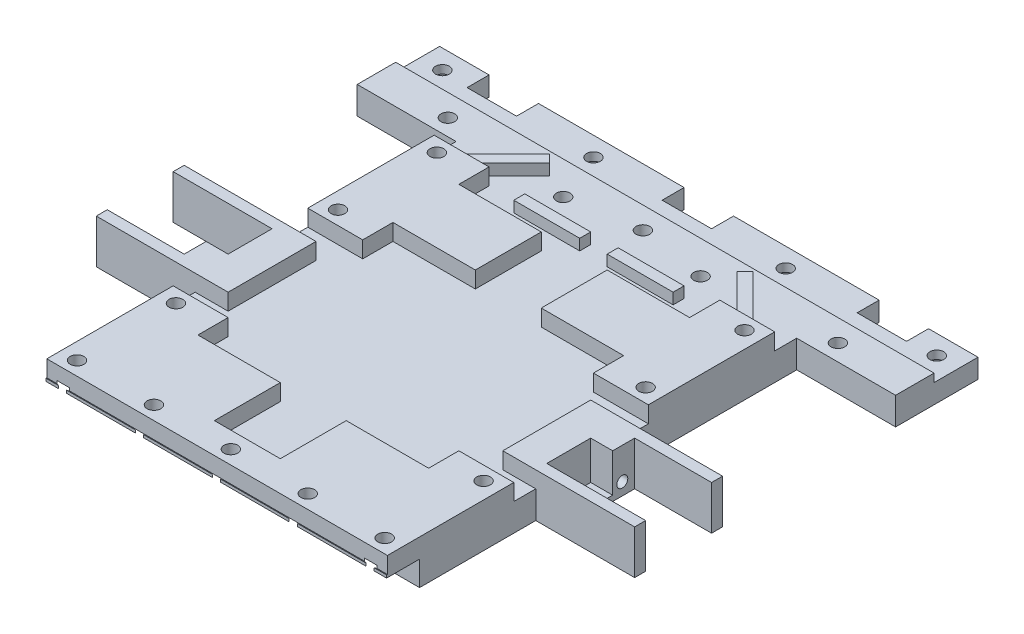
from build123d import *

# Parameters (mm, degrees)
KSZTA_T_OGOLNY_DEPTH            = 5
MIEJSCE_NA_SHARPY_DEPTH         = 19
MIEJSCE_NA_SHARPY_DEPTH_BACK    = 16.272781758
WCI_CIE_NA_SHARP_W              = 15
WCI_CIE_NA_SHARP_H              = 12
MIEJSCE_START                   = 5
WCI_CIE_NA_PO_CZENIEP_UGU_W     = 100
WCI_CIE_NA_PO_CZENIEP_UGU_H     = 8
MIEJSCE_NA_P_UG_DEPTH           = 1.5
WCI_CIA_NA_KTIRY_W              = 9
WCI_CIA_NA_KTIRY_H              = 14
MIEJSCE_NA_KTIR_DEPTH           = 3
SILNIKI_START                   = 5
PODWY_SZENIE_NA_SILNIKI_R       = 1.25
SILNIKI_PODWYZSZENIE_DEPTH      = 3
SILNIKI_DZIURY_DEPTH            = 35
SILNIKI_DZIURY_DEPTH_BACK       = 31
PODWY_SZENIE_NA_SILNIKI_3_R     = 1.25
OTWORY_NA_P_UG_DEPTH            = 42
OTWORY_NA_P_UG_DEPTH_BACK       = 56
OTWORY_NA_P_UG_2_R              = 1.25
OTWORY_TY_DEPTH                 = 54
OTWORY_TY_DEPTH_BACK            = 71
OTWORY_TY_RYS_R                 = 1.25
OTWORY_NA_PCB_PLUG_DEPTH        = 40
OTWORY_NA_PCB_PLUG_DEPTH_BACK   = 40.893066204
OTWORY_RYS_R                    = 1.25
KABLE_KTIR_DEPTH                = 61
KABLE_KTIR_DEPTH_BACK           = 85.532250354
MIEJSCE_NA_KABLE_KTIR_W         = 9
MIEJSCE_NA_KABLE_KTIR_H         = 4
OTWORY_MOCUJACE_KTIR_DEPTH      = 70
OTWORY_MOCUJACE_KTIR_DEPTH_BACK = 110.581826372
OTWORY_NA_MOCOWANIE_KTIR_RYS_R  = 1.25
GLOWKI_SRUB_R                   = 2.75
MIEJSCE_NA_SRUBKI_DEPTH         = 2
SKROCENIE_W                     = 62
SKROCENIE_H                     = 4.35
SKROCENIE_TYLU_DEPTH            = 5
WZMOCNIENIE_BOK_DEPTH           = 8
PRAWA_START                     = -15
PRAWA_STRONA_R                  = 1
PRAWA_STRONA_OTWOR_DEPTH        = 10
LEWA_START                      = 4
LEWA_STRONA_R                   = 1
LEWA_STRONA_OTWOR_DEPTH         = 10
ZAOKR_GLENIE1_R                 = 0.25
SZKIC1_W                        = 4
SZKIC1_H                        = 8
MIEJSCE_SHARP_DEPTH             = 7
GLOWKI_SRUB_2_R                 = 2.75
WIEKSZE_SROBKI_DEPTH            = 5.5
SZKIC3_W                        = 42
SZKIC3_H                        = 5.5
PODWYZSZENIE_TYL_DEPTH          = 3
OTWORY_TY_RYS_2_R               = 1.25
SROBKI_TYL_DEPTH                = 21
SZKIC5_W                        = 62.360867186
SZKIC5_H                        = 8
PODBICIETYL_DEPTH               = 4.5
ZWEZENIE_SZEROKOSCI_DEPTH       = 22
ZWEZENIE_SZEROKOSCI_DEPTH_BACK  = 46
SZKIC7_W                        = 1
SZKIC7_H                        = 65.630555857
SZKIC8_W                        = 12
SZKIC8_H                        = 2
SZARPY_PRZOD_MIEJSCA_DEPTH      = 2


with BuildPart() as part:
    # Kształt ogólny → Kształt ogolny (new body)
    with BuildSketch(Plane(origin=(0, 0, 0), x_dir=(1, 0, 0), z_dir=(0, 1, 0))):
        Polygon((0, 0), (-100, 0), (-100, -15), (-81, -15), (-81, -46.5), (-100, -46.5), (-100, -62.5), (-81, -62.5), (-81, -94), (-19, -94), (-19, -62.5), (0, -62.5), (0, -46.5), (-19, -46.5), (-19, -15), (0, -15), align=None)
    extrude(amount=KSZTA_T_OGOLNY_DEPTH)

    # Wcięcie na sharp → Miejsce na sharpy (cut, two sides: drawn at the far end of the back side and taken through both)
    with BuildSketch(Plane(origin=(0, 5, 0), x_dir=(1, 0, 0), z_dir=(0, 1, 0)).offset(-MIEJSCE_NA_SHARPY_DEPTH_BACK)):
        with Locations((-92.5, -54.5)):
            Rectangle(WCI_CIE_NA_SHARP_W, WCI_CIE_NA_SHARP_H)
        with Locations((-7.5, -54.5)):
            Rectangle(WCI_CIE_NA_SHARP_W, WCI_CIE_NA_SHARP_H)
    extrude(amount=MIEJSCE_NA_SHARPY_DEPTH + MIEJSCE_NA_SHARPY_DEPTH_BACK, mode=Mode.SUBTRACT)

    # Wcięcie na połączeniepługu → Miejsce na pług (cut)
    with BuildSketch(Plane(origin=(0, 0, 0), x_dir=(1, 0, 0), z_dir=(0, 1, 0)).offset(MIEJSCE_START)):
        with Locations((-50, -4)):
            Rectangle(WCI_CIE_NA_PO_CZENIEP_UGU_W, WCI_CIE_NA_PO_CZENIEP_UGU_H)
    extrude(amount=-MIEJSCE_NA_P_UG_DEPTH, mode=Mode.SUBTRACT)

    # Wcięcia na ktiry → Miejsce na ktir (cut)
    with BuildSketch(Plane(origin=(0, 0, 0), x_dir=(1, 0, 0), z_dir=(0, 1, 0))):
        with Locations((-85.5, -7)):
            Rectangle(WCI_CIA_NA_KTIRY_W, WCI_CIA_NA_KTIRY_H)
        with Locations((-50, -7)):
            Rectangle(WCI_CIA_NA_KTIRY_W, WCI_CIA_NA_KTIRY_H)
        with Locations((-14.5, -7)):
            Rectangle(WCI_CIA_NA_KTIRY_W, WCI_CIA_NA_KTIRY_H)
    extrude(amount=MIEJSCE_NA_KTIR_DEPTH, mode=Mode.SUBTRACT)

    # Podwyższenie na silniki → Silniki - podwyzszenie (add)
    # profile 1 of 4: a face of its own
    with BuildSketch(Plane(origin=(0, 0, 0), x_dir=(1, 0, 0), z_dir=(0, 1, 0)).offset(SILNIKI_START)):
        Polygon((-81, -66.5), (-71, -66.5), (-71, -72), (-56, -72), (-56, -84), (-71, -84), (-71, -89.5), (-81, -89.5), align=None)
        with Locations(Location((-78, -69, 0), (0, 0, 270))):
            Circle(PODWY_SZENIE_NA_SILNIKI_R, mode=Mode.SUBTRACT)
        with Locations(Location((-78, -87, 0), (0, 0, 270))):
            Circle(PODWY_SZENIE_NA_SILNIKI_R, mode=Mode.SUBTRACT)
    # profile 2 of 4: a face of its own
    with BuildSketch(Plane(origin=(0, 0, 0), x_dir=(1, 0, 0), z_dir=(0, 1, 0)).offset(SILNIKI_START)):
        Polygon((-19, -89.5), (-29, -89.5), (-29, -84), (-44, -84), (-44, -72), (-29, -72), (-29, -66.5), (-19, -66.5), align=None)
        with Locations(Location((-22, -69, 0), (0, 0, 270))):
            Circle(PODWY_SZENIE_NA_SILNIKI_R, mode=Mode.SUBTRACT)
        with Locations(Location((-22, -87, 0), (0, 0, 270))):
            Circle(PODWY_SZENIE_NA_SILNIKI_R, mode=Mode.SUBTRACT)
    # profile 3 of 4: a face of its own
    with BuildSketch(Plane(origin=(0, 0, 0), x_dir=(1, 0, 0), z_dir=(0, 1, 0)).offset(SILNIKI_START)):
        Polygon((-81, -19), (-71, -19), (-71, -24.5), (-56, -24.5), (-56, -36.5), (-71, -36.5), (-71, -42), (-81, -42), align=None)
        with Locations(Location((-78, -21.5, 0), (0, 0, 270))):
            Circle(PODWY_SZENIE_NA_SILNIKI_R, mode=Mode.SUBTRACT)
        with Locations(Location((-78, -39.5, 0), (0, 0, 270))):
            Circle(PODWY_SZENIE_NA_SILNIKI_R, mode=Mode.SUBTRACT)
    # profile 4 of 4: a face of its own
    with BuildSketch(Plane(origin=(0, 0, 0), x_dir=(1, 0, 0), z_dir=(0, 1, 0)).offset(SILNIKI_START)):
        Polygon((-19, -19), (-29, -19), (-29, -24.5), (-44, -24.5), (-44, -36.5), (-29, -36.5), (-29, -42), (-19, -42), align=None)
        with Locations(Location((-22, -21.5, 0), (0, 0, 270))):
            Circle(PODWY_SZENIE_NA_SILNIKI_R, mode=Mode.SUBTRACT)
        with Locations(Location((-22, -39.5, 0), (0, 0, 270))):
            Circle(PODWY_SZENIE_NA_SILNIKI_R, mode=Mode.SUBTRACT)
    extrude(amount=SILNIKI_PODWYZSZENIE_DEPTH)

    # Podwyższenie na silniki<3> → Silniki -dziury (cut, two sides: drawn at the far end of the back side and taken through both)
    with BuildSketch(Plane(origin=(0, 0, 0), x_dir=(1, 0, 0), z_dir=(0, 1, 0)).offset(-SILNIKI_DZIURY_DEPTH_BACK)):
        with Locations(Location((-78, -87, 0), (0, 0, 270))):
            Circle(PODWY_SZENIE_NA_SILNIKI_3_R)
        with Locations(Location((-78, -69, 0), (0, 0, 270))):
            Circle(PODWY_SZENIE_NA_SILNIKI_3_R)
        with Locations(Location((-78, -39.5, 0), (0, 0, 270))):
            Circle(PODWY_SZENIE_NA_SILNIKI_3_R)
        with Locations(Location((-78, -21.5, 0), (0, 0, 270))):
            Circle(PODWY_SZENIE_NA_SILNIKI_3_R)
        with Locations(Location((-22, -21.5, 0), (0, 0, 270))):
            Circle(PODWY_SZENIE_NA_SILNIKI_3_R)
        with Locations(Location((-22, -39.5, 0), (0, 0, 270))):
            Circle(PODWY_SZENIE_NA_SILNIKI_3_R)
        with Locations(Location((-22, -69, 0), (0, 0, 270))):
            Circle(PODWY_SZENIE_NA_SILNIKI_3_R)
        with Locations(Location((-22, -87, 0), (0, 0, 270))):
            Circle(PODWY_SZENIE_NA_SILNIKI_3_R)
    extrude(amount=SILNIKI_DZIURY_DEPTH + SILNIKI_DZIURY_DEPTH_BACK, mode=Mode.SUBTRACT)

    # Otwory na p_ug 2 → Otwory na p_ug (cut, two sides: drawn at the far end of the back side and taken through both)
    with BuildSketch(Plane(origin=(0, 0, 0), x_dir=(1, 0, 0), z_dir=(0, 1, 0)).offset(-OTWORY_NA_P_UG_DEPTH_BACK)):
        with Locations(Location((-95, -3.5, 0), (0, 0, 90))):
            Circle(OTWORY_NA_P_UG_2_R)
        with Locations(Location((-67.5, -3.5, 0), (0, 0, 90))):
            Circle(OTWORY_NA_P_UG_2_R)
        with Locations(Location((-32.5, -3.5, 0), (0, 0, 90))):
            Circle(OTWORY_NA_P_UG_2_R)
        with Locations(Location((-5, -3.5, 0), (0, 0, 90))):
            Circle(OTWORY_NA_P_UG_2_R)
    extrude(amount=OTWORY_NA_P_UG_DEPTH + OTWORY_NA_P_UG_DEPTH_BACK, mode=Mode.SUBTRACT)

    # Otwory tył(rys) → Otwory tył (cut, two sides: drawn at the far end of the back side and taken through both)
    with BuildSketch(Plane(origin=(0, 0, 0), x_dir=(1, 0, 0), z_dir=(0, 1, 0)).offset(-OTWORY_TY_DEPTH_BACK)):
        with Locations(Location((-50, -87, 0), (0, 0, 270))):
            Circle(OTWORY_TY_RYS_R)
        with Locations(Location((-36, -87, 0), (0, 0, 270))):
            Circle(OTWORY_TY_RYS_R)
        with Locations(Location((-64, -87, 0), (0, 0, 270))):
            Circle(OTWORY_TY_RYS_R)
    extrude(amount=OTWORY_TY_DEPTH + OTWORY_TY_DEPTH_BACK, mode=Mode.SUBTRACT)

    # Otwory rys → Otwory na pcb/plug (cut, two sides: drawn at the far end of the back side and taken through both)
    with BuildSketch(Plane(origin=(0, 0, 0), x_dir=(1, 0, 0), z_dir=(0, 1, 0)).offset(-OTWORY_NA_PCB_PLUG_DEPTH_BACK)):
        with Locations(Location((-62.5, -14, 0), (0, 0, 90))):
            Circle(OTWORY_RYS_R)
        with Locations(Location((-37.5, -14, 0), (0, 0, 90))):
            Circle(OTWORY_RYS_R)
    extrude(amount=OTWORY_NA_PCB_PLUG_DEPTH + OTWORY_NA_PCB_PLUG_DEPTH_BACK, mode=Mode.SUBTRACT)

    # Miejsce na kable ktir → Kable ktir (cut, two sides: drawn at the far end of the back side and taken through both)
    with BuildSketch(Plane(origin=(0, 3.5, 0), x_dir=(1, 0, 0), z_dir=(0, 1, 0)).offset(-KABLE_KTIR_DEPTH_BACK)):
        with Locations((-50, -2)):
            Rectangle(MIEJSCE_NA_KABLE_KTIR_W, MIEJSCE_NA_KABLE_KTIR_H)
        with Locations((-14.5, -2)):
            Rectangle(MIEJSCE_NA_KABLE_KTIR_W, MIEJSCE_NA_KABLE_KTIR_H)
        with Locations((-85.5, -2)):
            Rectangle(MIEJSCE_NA_KABLE_KTIR_W, MIEJSCE_NA_KABLE_KTIR_H)
    extrude(amount=KABLE_KTIR_DEPTH + KABLE_KTIR_DEPTH_BACK, mode=Mode.SUBTRACT)

    # Otwory na mocowanie ktir rys → Otwory mocujace ktir (cut, two sides: drawn at the far end of the back side and taken through both)
    with BuildSketch(Plane(origin=(0, 3.5, 0), x_dir=(1, 0, 0), z_dir=(0, 1, 0)).offset(-OTWORY_MOCUJACE_KTIR_DEPTH_BACK)):
        with Locations(Location((-14.5, -12, 0), (0, 0, 270))):
            Circle(OTWORY_NA_MOCOWANIE_KTIR_RYS_R)
        with Locations(Location((-50, -12, 0), (0, 0, 270))):
            Circle(OTWORY_NA_MOCOWANIE_KTIR_RYS_R)
        with Locations(Location((-85.5, -12, 0), (0, 0, 270))):
            Circle(OTWORY_NA_MOCOWANIE_KTIR_RYS_R)
    extrude(amount=OTWORY_MOCUJACE_KTIR_DEPTH + OTWORY_MOCUJACE_KTIR_DEPTH_BACK, mode=Mode.SUBTRACT)

    # glowki srub → miejsce na srubki (cut)
    with BuildSketch(Plane(origin=(0, 0, 0), x_dir=(-1, 0, 0), z_dir=(0, -1, 0))):
        with Locations(Location((22, -21.5, 0), (0, 0, 90))):
            Circle(GLOWKI_SRUB_R)
        with Locations(Location((37.5, -14, 0), (0, 0, 90))):
            Circle(GLOWKI_SRUB_R)
        with Locations(Location((62.5, -14, 0), (0, 0, 90))):
            Circle(GLOWKI_SRUB_R)
        with Locations(Location((78, -21.5, 0), (0, 0, 90))):
            Circle(GLOWKI_SRUB_R)
        with Locations(Location((78, -39.5, 0), (0, 0, 90))):
            Circle(GLOWKI_SRUB_R)
        with Locations(Location((22, -39.5, 0), (0, 0, 90))):
            Circle(GLOWKI_SRUB_R)
        with Locations(Location((22, -69, 0), (0, 0, 90))):
            Circle(GLOWKI_SRUB_R)
        with Locations(Location((22, -87, 0), (0, 0, 90))):
            Circle(GLOWKI_SRUB_R)
        with Locations(Location((78, -87, 0), (0, 0, 90))):
            Circle(GLOWKI_SRUB_R)
        with Locations(Location((78, -69, 0), (0, 0, 90))):
            Circle(GLOWKI_SRUB_R)
        with Locations(Location((36, -87, 0), (0, 0, 90))):
            Circle(GLOWKI_SRUB_R)
        with Locations(Location((50, -87, 0), (0, 0, 90))):
            Circle(GLOWKI_SRUB_R)
        with Locations(Location((64, -87, 0), (0, 0, 90))):
            Circle(GLOWKI_SRUB_R)
        with Locations(Location((5, -3.5, 0), (0, 0, 90))):
            Circle(GLOWKI_SRUB_R)
        with Locations(Location((32.5, -3.5, 0), (0, 0, 90))):
            Circle(GLOWKI_SRUB_R)
        with Locations(Location((67.5, -3.5, 0), (0, 0, 90))):
            Circle(GLOWKI_SRUB_R)
        with Locations(Location((95, -3.5, 0), (0, 0, 90))):
            Circle(GLOWKI_SRUB_R)
    extrude(amount=-MIEJSCE_NA_SRUBKI_DEPTH, mode=Mode.SUBTRACT)

    # skrocenie → skrocenie tylu (cut)
    with BuildSketch(Plane(origin=(0, 0, 0), x_dir=(-1, 0, 0), z_dir=(0, -1, 0))):
        with Locations((50, -91.825)):
            Rectangle(SKROCENIE_W, SKROCENIE_H)
    extrude(amount=-SKROCENIE_TYLU_DEPTH, mode=Mode.SUBTRACT)

    # wzmocnienie → wzmocnienie bok (add)
    with BuildSketch(Plane.XZ):
        Polygon((0, 46.5), (-25, 46.5), (-25, 62.5), (0, 62.5), (0, 60.5), (-15, 60.5), (-15, 48.5), (0, 48.5), align=None)
        Polygon((-100, 62.5), (-75, 62.5), (-75, 46.5), (-100, 46.5), (-100, 48.5), (-85, 48.5), (-85, 60.5), (-100, 60.5), align=None)
    extrude(amount=-WZMOCNIENIE_BOK_DEPTH)

    # prawa strona → prawa strona otwor (cut)
    with BuildSketch(Plane(origin=(0, 0, 0), x_dir=(0, 0, -1), z_dir=(1, 0, 0)).offset(PRAWA_START)):
        with Locations((-50.75, 2.25)):
            Circle(PRAWA_STRONA_R)
    extrude(amount=-PRAWA_STRONA_OTWOR_DEPTH, mode=Mode.SUBTRACT)

    # lewa strona → lewa strona otwor (cut)
    with BuildSketch(Plane.ZY.offset(81).offset(LEWA_START)):
        with Locations((58.25, 2.25)):
            Circle(LEWA_STRONA_R)
    extrude(amount=-LEWA_STRONA_OTWOR_DEPTH, mode=Mode.SUBTRACT)

    # Zaokrąglenie1
    zaokr_glenie1_edges = [part.edges().sort_by_distance(p)[0] for p in [
        (-22, 0, 71.75),
        (-22, 0, 42.25),
        (-78, 0, 42.25),
        (-78, 0, 24.25),
        (-62.5, 0, 16.75),
        (-37.5, 0, 16.75),
        (-78, 0, 71.75),
        (-5, 0, 6.25),
        (-32.5, 0, 6.25),
        (-67.5, 0, 6.25),
        (-95, 0, 6.25),
        (-22, 0, 24.25),
        (-22, 0, 84.25),
        (-78, 0, 84.25),
        (-50, 0, 84.25),
        (-36, 0, 84.25),
        (-64, 0, 84.25),
    ]]
    fillet(zaokr_glenie1_edges, radius=ZAOKR_GLENIE1_R - 0.0001)  # a hair under: the kernel refuses the full size

    # Szkic1 → Miejsce sharp (cut)
    with BuildSketch(Plane(origin=(0, 8, 0), x_dir=(1, 0, 0), z_dir=(0, 1, 0))):
        with Locations((-83, -52.5)):
            Rectangle(SZKIC1_W, SZKIC1_H)
        with Locations((-17, -56.5)):
            Rectangle(SZKIC1_W, SZKIC1_H)
    extrude(amount=-MIEJSCE_SHARP_DEPTH, mode=Mode.SUBTRACT)

    # glowki srub<2> → wieksze srobki (cut)
    with BuildSketch(Plane(origin=(0, 0, 0), x_dir=(-1, 0, 0), z_dir=(0, -1, 0))):
        with Locations((50, -87)):
            Circle(GLOWKI_SRUB_2_R)
        with Locations((22, -87)):
            Circle(GLOWKI_SRUB_2_R)
        with Locations((36, -87)):
            Circle(GLOWKI_SRUB_2_R)
        with Locations((64, -87)):
            Circle(GLOWKI_SRUB_2_R)
        with Locations((78, -87)):
            Circle(GLOWKI_SRUB_2_R)
    extrude(amount=-WIEKSZE_SROBKI_DEPTH, mode=Mode.SUBTRACT)

    # Szkic3 → podwyzszenie tyl (add)
    with BuildSketch(Plane(origin=(0, 5, 0), x_dir=(1, 0, 0), z_dir=(0, 1, 0))):
        with Locations((-50, -86.75)):
            Rectangle(SZKIC3_W, SZKIC3_H)
    extrude(amount=PODWYZSZENIE_TYL_DEPTH)

    # Otwory tył(rys)<2> → srobki tyl (cut)
    with BuildSketch(Plane(origin=(0, 0, 0), x_dir=(1, 0, 0), z_dir=(0, 1, 0))):
        with Locations(Location((-50, -87, 0), (0, 0, 90))):
            Circle(OTWORY_TY_RYS_2_R)
        with Locations(Location((-36, -87, 0), (0, 0, 90))):
            Circle(OTWORY_TY_RYS_2_R)
        with Locations(Location((-64, -87, 0), (0, 0, 90))):
            Circle(OTWORY_TY_RYS_2_R)
    extrude(amount=SROBKI_TYL_DEPTH, mode=Mode.SUBTRACT)

    # Szkic5 → podbicietyl (cut)
    with BuildSketch(Plane(origin=(0, 0, 0), x_dir=(-1, 0, 0), z_dir=(0, -1, 0))):
        with Locations((49.819566407, -87.65)):
            Rectangle(SZKIC5_W, SZKIC5_H)
    extrude(amount=-PODBICIETYL_DEPTH, mode=Mode.SUBTRACT)

    # Szkic7 → zwezenie szerokosci (cut, two sides: drawn at the far end of the back side and taken through both)
    with BuildSketch(Plane(origin=(0, 0, 0), x_dir=(-1, 0, 0), z_dir=(0, -1, 0)).offset(-ZWEZENIE_SZEROKOSCI_DEPTH_BACK)):
        with Locations((0.5, -32.815277929)):
            Rectangle(SZKIC7_W, SZKIC7_H)
        Polygon((103, 0), (100, 0), (99, 0), (99, -70.755678121), (103, -70.755678121), align=None)
    extrude(amount=ZWEZENIE_SZEROKOSCI_DEPTH + ZWEZENIE_SZEROKOSCI_DEPTH_BACK, mode=Mode.SUBTRACT)

    # Szkic8 → Szarpy przod miejsca (add)
    with BuildSketch(Plane(origin=(0, 5, 0), x_dir=(1, 0, 0), z_dir=(0, 1, 0))):
        Polygon((-68.514718626, -10.514718626), (-77, -19), (-76, -19), (-74.171572875, -19), (-67.100505063, -11.928932188), align=None)
        with Locations((-58.5, -20)):
            Rectangle(SZKIC8_W, SZKIC8_H)
        with Locations((-41.5, -20)):
            Rectangle(SZKIC8_W, SZKIC8_H)
        Polygon((-25.828427125, -19), (-23, -19), (-31.485281374, -10.514718626), (-32.899494937, -11.928932188), align=None)
    extrude(amount=SZARPY_PRZOD_MIEJSCA_DEPTH)


solid = part.part
